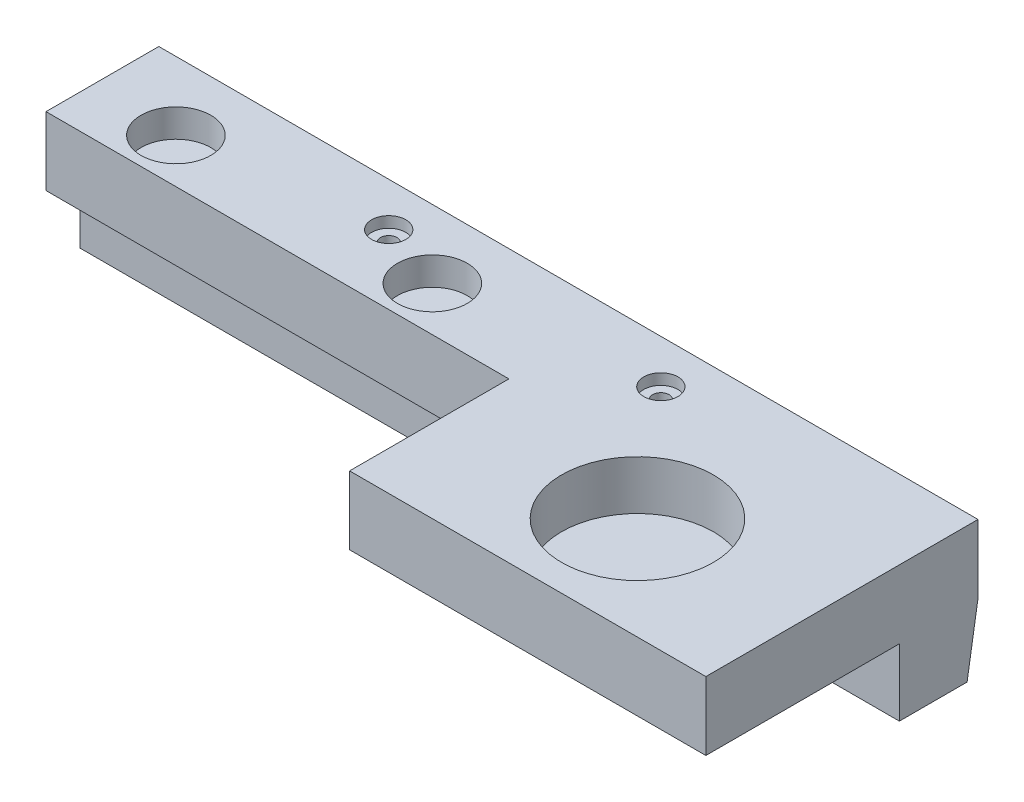
from build123d import *

# Parameters (mm, degrees)
SZKIC1_W                                             = 119.8
SZKIC1_H                                             = 10
DODANIE_WYCI_GNI_CIE2_DEPTH                          = 38.3
SZKIC21_W                                            = 119.8
SZKIC21_H                                            = 10
DODANIE_WYCI_GNI_CIE3_DEPTH                          = 9.8
POG_BIENIE_WALCOWE_POD_M2_WKR_T_DO_CZ_CI_D           = 2.4
POG_BIENIE_WALCOWE_POD_M2_WKR_T_DO_CZ_CI_CBORE_D     = 5
POG_BIENIE_WALCOWE_POD_M2_WKR_T_DO_CZ_CI_CBORE_DEPTH = 1.6
SZKIC28_R                                            = 11.1
WYTNIJ_WYCI_GNI_CIE1_DEPTH                           = 7.2
WYTNIJ_WYCI_GNI_CIE4_DEPTH                           = 124.8
DODANIE_WYCI_GNI_CIE5_DEPTH                          = 119.8
SZKIC34_W                                            = 119.8
SZKIC34_H                                            = 10
DODANIE_WYCI_GNI_CIE6_DEPTH                          = 1.5
SZKIC38_W                                            = 67.7
SZKIC38_H                                            = 10
WYTNIJ_WYCI_GNI_CIE5_DEPTH                           = 23.3
SZKIC39_R                                            = 5.1
WYTNIJ_WYCI_GNI_CIE6_DEPTH                           = 4.1


with BuildPart() as part:
    # Szkic1 → Dodanie-wyciągnięcie2 (new body)
    with BuildSketch(Plane.XY):
        with Locations((1.59336777, 27.024849398)):
            Rectangle(SZKIC1_W, SZKIC1_H)
    extrude(amount=DODANIE_WYCI_GNI_CIE2_DEPTH)

    # Szkic21 → Dodanie-wyciągnięcie3 (add)
    with BuildSketch(Plane(origin=(0, 32.024849398, 0), x_dir=(1, 0, 0), z_dir=(0, 1, 0))):
        with Locations((1.59336777, -5)):
            Rectangle(SZKIC21_W, SZKIC21_H)
    extrude(amount=DODANIE_WYCI_GNI_CIE3_DEPTH)

    # Pogłębienie walcowe pod M2 wkręt do części metalowych z łbem stożkowym ściętym2 (through all)
    with Locations(Plane(origin=(0, 22.024849398, 0), x_dir=(-1, 0, 0), z_dir=(0, -1, 0))):
        with Locations((-21.49336777, -4.88), (18.30663223, -4.88)):
            CounterBoreHole(POG_BIENIE_WALCOWE_POD_M2_WKR_T_DO_CZ_CI_D / 2, POG_BIENIE_WALCOWE_POD_M2_WKR_T_DO_CZ_CI_CBORE_D / 2, POG_BIENIE_WALCOWE_POD_M2_WKR_T_DO_CZ_CI_CBORE_DEPTH)

    # Szkic28 → Wytnij-wyciągnięcie1 (cut)
    with BuildSketch(Plane.XZ.offset(-22.024849398)):
        with Locations((36.49336777, 23.3)):
            Circle(SZKIC28_R)
    extrude(amount=-WYTNIJ_WYCI_GNI_CIE1_DEPTH, mode=Mode.SUBTRACT)

    # Szkic31 → Wytnij-wyciągnięcie4 (cut)
    with BuildSketch(Plane(origin=(61.49336777, 0, 0), x_dir=(0, 0, -1), z_dir=(1, 0, 0))):
        Polygon((0, 41.824849398), (-0.096491228, 41.824849398), (0, 41.232541705), align=None)
    extrude(amount=-WYTNIJ_WYCI_GNI_CIE4_DEPTH, mode=Mode.SUBTRACT)

    # Szkic31<5> → Dodanie-wyciągnięcie5 (add)
    with BuildSketch(Plane(origin=(61.49336777, 0, 0), x_dir=(0, 0, -1), z_dir=(1, 0, 0))):
        Polygon((0, 41.232541705), (0, 32.024849398), (1.5, 32.024849398), (0.275236278, 39.543014399), align=None)
    extrude(amount=-DODANIE_WYCI_GNI_CIE5_DEPTH)

    # Szkic34 → Dodanie-wyciągnięcie6 (add)
    with BuildSketch(Plane(origin=(0, 0, 0), x_dir=(-1, 0, 0), z_dir=(0, 0, -1))):
        with Locations((-1.59336777, 27.024849398)):
            Rectangle(SZKIC34_W, SZKIC34_H)
    extrude(amount=DODANIE_WYCI_GNI_CIE6_DEPTH)


with BuildPart() as body_2:
    # Lustro2: mirrored copy
    add(part.part.mirror(Plane(origin=(-58.30663223, 22.024849398, 38.3), x_dir=(0, 0, 1), z_dir=(0, 1, 0))))


with BuildPart() as body_2_1:
    # Obiekt-Przenieś/Kopiuj1: moved
    add(body_2.part.moved(Location((0, -36.76628261, 0))))

    # Szkic38 → Wytnij-wyciągnięcie5 (cut)
    with BuildSketch(Plane.XY.offset(38.3)):
        with Locations((-24.45663223, -19.741433212)):
            Rectangle(SZKIC38_W, SZKIC38_H)
    extrude(amount=-WYTNIJ_WYCI_GNI_CIE5_DEPTH, mode=Mode.SUBTRACT)

    # Szkic39 → Wytnij-wyciągnięcie6 (cut)
    with BuildSketch(Plane(origin=(0, -14.741433212, 0), x_dir=(1, 0, 0), z_dir=(0, 1, 0))):
        with Locations((-45.80663223, -8.5)):
            Circle(SZKIC39_R)
        with Locations((-8.30663223, -8.5)):
            Circle(SZKIC39_R)
    extrude(amount=-WYTNIJ_WYCI_GNI_CIE6_DEPTH, mode=Mode.SUBTRACT)


solid = body_2_1.part
